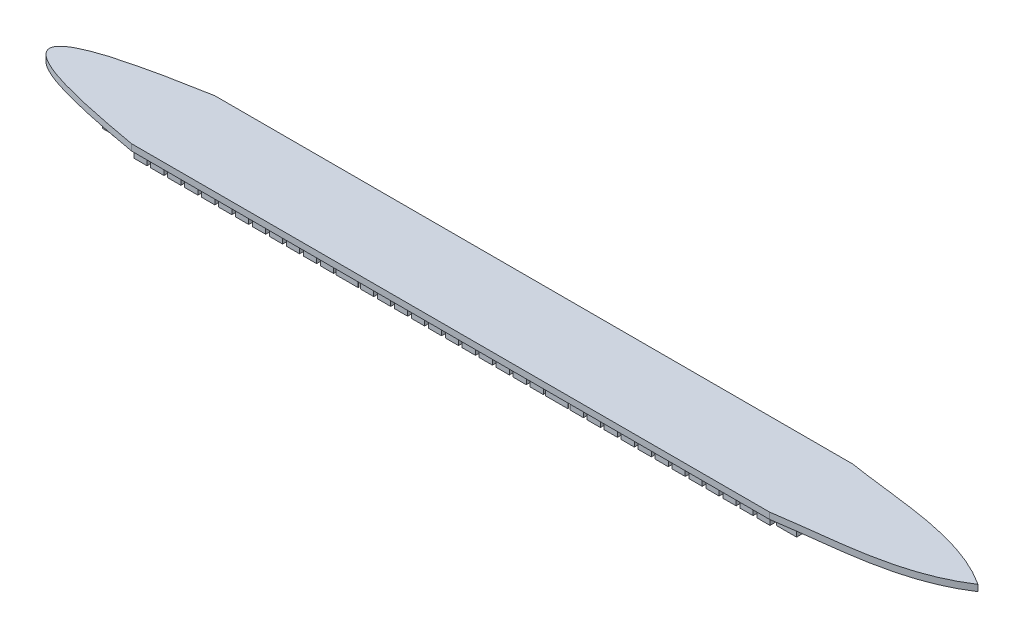
from build123d import *

# Parameters (mm, degrees)
SEATING_LAYOUT_W      = 457.2
SEATING_LAYOUT_H      = 635
SEATINGS_DEPTH        = 304.8
EMERGENCY_DOORS_W     = 30.48
EMERGENCY_DOORS_H     = 1066.8
EM_DOORS_DEPTH        = 304.8
EM_DOORS_2_DEPTH      = 304.8
EM_DOORS_3_DEPTH      = 304.8
EM_DOORS_4_DEPTH      = 304.8
LAVATORIES_W          = 1016
LAVATORIES_H          = 965.2
LAV_DEPTH             = 304.8
LAV_2_DEPTH           = 304.8
LAVATORIES_W_2        = 965.2
LAV_3_DEPTH           = 304.8
LAV_4_DEPTH           = 304.8
LAV_5_DEPTH           = 304.8
GALLEY_CARTS_W        = 914.4
GALLEY_CARTS_H        = 381
GALLEY_DEPTH          = 304.8
GALLEY_2_DEPTH        = 304.8
GALLEY_3_DEPTH        = 304.8
GALLEY_4_DEPTH        = 304.8
GALLEY_5_DEPTH        = 304.8
GALLEY_6_DEPTH        = 304.8
GALLEY_7_DEPTH        = 304.8
GALLEY_8_DEPTH        = 304.8
GALLEY_9_DEPTH        = 304.8
GALLEY_10_DEPTH       = 304.8
GALLEY_11_DEPTH       = 304.8
GALLEY_12_DEPTH       = 304.8
GALLEY_13_DEPTH       = 304.8
GALLEY_14_DEPTH       = 304.8
GALLEY_15_DEPTH       = 304.8
FLOOR_2_DEPTH         = 304.8
BODY_MOVE_COPY1_ANGLE = 90


with BuildPart() as part:
    # Seating layout → Seatings (new body)
    with BuildSketch(Plane(origin=(0, 0, 0), x_dir=(1, 0, 0), z_dir=(0, 1, 0))):
        with Locations((-1193.292, -14930.966666667)):
            Rectangle(SEATING_LAYOUT_W, SEATING_LAYOUT_H)
        with Locations((-1701.292, -14930.966666667)):
            Rectangle(SEATING_LAYOUT_W, SEATING_LAYOUT_H)
        with Locations((-685.292, -14930.966666667)):
            Rectangle(SEATING_LAYOUT_W, SEATING_LAYOUT_H)
        with Locations((-1193.292, -14118.166666667)):
            Rectangle(SEATING_LAYOUT_W, SEATING_LAYOUT_H)
        with Locations((-685.292, -14118.166666667)):
            Rectangle(SEATING_LAYOUT_W, SEATING_LAYOUT_H)
        with Locations((-1193.292, -13305.366666667)):
            Rectangle(SEATING_LAYOUT_W, SEATING_LAYOUT_H)
        with Locations((-685.292, -13305.366666667)):
            Rectangle(SEATING_LAYOUT_W, SEATING_LAYOUT_H)
        with Locations((-1701.292, -14118.166666667)):
            Rectangle(SEATING_LAYOUT_W, SEATING_LAYOUT_H)
        with Locations((-1701.292, -13305.366666667)):
            Rectangle(SEATING_LAYOUT_W, SEATING_LAYOUT_H)
        with Locations((-1701.292, -12492.566666667)):
            Rectangle(SEATING_LAYOUT_W, SEATING_LAYOUT_H)
        with Locations((-1193.292, -12492.566666667)):
            Rectangle(SEATING_LAYOUT_W, SEATING_LAYOUT_H)
        with Locations((-685.292, -12492.566666667)):
            Rectangle(SEATING_LAYOUT_W, SEATING_LAYOUT_H)
        with Locations((-1701.292, -11679.766666667)):
            Rectangle(SEATING_LAYOUT_W, SEATING_LAYOUT_H)
        with Locations((-1193.292, -11679.766666667)):
            Rectangle(SEATING_LAYOUT_W, SEATING_LAYOUT_H)
        with Locations((-685.292, -11679.766666667)):
            Rectangle(SEATING_LAYOUT_W, SEATING_LAYOUT_H)
        with Locations((-1701.292, -10866.966666667)):
            Rectangle(SEATING_LAYOUT_W, SEATING_LAYOUT_H)
        with Locations((-1193.292, -10866.966666667)):
            Rectangle(SEATING_LAYOUT_W, SEATING_LAYOUT_H)
        with Locations((-685.292, -10866.966666667)):
            Rectangle(SEATING_LAYOUT_W, SEATING_LAYOUT_H)
        with Locations((-1701.292, -10054.166666667)):
            Rectangle(SEATING_LAYOUT_W, SEATING_LAYOUT_H)
        with Locations((-1193.292, -10054.166666667)):
            Rectangle(SEATING_LAYOUT_W, SEATING_LAYOUT_H)
        with Locations((-685.292, -10054.166666667)):
            Rectangle(SEATING_LAYOUT_W, SEATING_LAYOUT_H)
        with Locations((-1701.292, -9241.366666667)):
            Rectangle(SEATING_LAYOUT_W, SEATING_LAYOUT_H)
        with Locations((-1193.292, -9241.366666667)):
            Rectangle(SEATING_LAYOUT_W, SEATING_LAYOUT_H)
        with Locations((-685.292, -9241.366666667)):
            Rectangle(SEATING_LAYOUT_W, SEATING_LAYOUT_H)
        with Locations((-1701.292, -8428.566666667)):
            Rectangle(SEATING_LAYOUT_W, SEATING_LAYOUT_H)
        with Locations((-1193.292, -8428.566666667)):
            Rectangle(SEATING_LAYOUT_W, SEATING_LAYOUT_H)
        with Locations((-685.292, -8428.566666667)):
            Rectangle(SEATING_LAYOUT_W, SEATING_LAYOUT_H)
        with Locations((-1701.292, -7615.766666667)):
            Rectangle(SEATING_LAYOUT_W, SEATING_LAYOUT_H)
        with Locations((-1193.292, -7615.766666667)):
            Rectangle(SEATING_LAYOUT_W, SEATING_LAYOUT_H)
        with Locations((-685.292, -7615.766666667)):
            Rectangle(SEATING_LAYOUT_W, SEATING_LAYOUT_H)
        with Locations((-1701.292, -6802.966666667)):
            Rectangle(SEATING_LAYOUT_W, SEATING_LAYOUT_H)
        with Locations((-1193.292, -6802.966666667)):
            Rectangle(SEATING_LAYOUT_W, SEATING_LAYOUT_H)
        with Locations((-685.292, -6802.966666667)):
            Rectangle(SEATING_LAYOUT_W, SEATING_LAYOUT_H)
        with Locations((-1701.292, -5990.166666667)):
            Rectangle(SEATING_LAYOUT_W, SEATING_LAYOUT_H)
        with Locations((-1193.292, -5990.166666667)):
            Rectangle(SEATING_LAYOUT_W, SEATING_LAYOUT_H)
        with Locations((-685.292, -5990.166666667)):
            Rectangle(SEATING_LAYOUT_W, SEATING_LAYOUT_H)
        with Locations((-1701.292, -4064)):
            Rectangle(SEATING_LAYOUT_W, SEATING_LAYOUT_H)
        with Locations((-1193.292, -4064)):
            Rectangle(SEATING_LAYOUT_W, SEATING_LAYOUT_H)
        with Locations((-685.292, -4064)):
            Rectangle(SEATING_LAYOUT_W, SEATING_LAYOUT_H)
        with Locations((-1193.292, -3251.2)):
            Rectangle(SEATING_LAYOUT_W, SEATING_LAYOUT_H)
        with Locations((-685.292, -3251.2)):
            Rectangle(SEATING_LAYOUT_W, SEATING_LAYOUT_H)
        with Locations((-1193.292, -2438.4)):
            Rectangle(SEATING_LAYOUT_W, SEATING_LAYOUT_H)
        with Locations((-685.292, -2438.4)):
            Rectangle(SEATING_LAYOUT_W, SEATING_LAYOUT_H)
        with Locations((-1193.292, -1625.6)):
            Rectangle(SEATING_LAYOUT_W, SEATING_LAYOUT_H)
        with Locations((-685.292, -1625.6)):
            Rectangle(SEATING_LAYOUT_W, SEATING_LAYOUT_H)
        with Locations((-1193.292, -812.8)):
            Rectangle(SEATING_LAYOUT_W, SEATING_LAYOUT_H)
        with Locations((-685.292, -812.8)):
            Rectangle(SEATING_LAYOUT_W, SEATING_LAYOUT_H)
        with Locations((-1701.292, -3251.2)):
            Rectangle(SEATING_LAYOUT_W, SEATING_LAYOUT_H)
        with Locations((-1701.292, -2438.4)):
            Rectangle(SEATING_LAYOUT_W, SEATING_LAYOUT_H)
        with Locations((-1701.292, -1625.6)):
            Rectangle(SEATING_LAYOUT_W, SEATING_LAYOUT_H)
        with Locations((-1701.292, -812.8)):
            Rectangle(SEATING_LAYOUT_W, SEATING_LAYOUT_H)
        with Locations((-1701.292, 0)):
            Rectangle(SEATING_LAYOUT_W, SEATING_LAYOUT_H)
        with Locations((-1193.292, 0)):
            Rectangle(SEATING_LAYOUT_W, SEATING_LAYOUT_H)
        with Locations((-685.292, 0)):
            Rectangle(SEATING_LAYOUT_W, SEATING_LAYOUT_H)
        with Locations((-1701.292, 812.8)):
            Rectangle(SEATING_LAYOUT_W, SEATING_LAYOUT_H)
        with Locations((-1193.292, 812.8)):
            Rectangle(SEATING_LAYOUT_W, SEATING_LAYOUT_H)
        with Locations((-685.292, 812.8)):
            Rectangle(SEATING_LAYOUT_W, SEATING_LAYOUT_H)
        with Locations((-1701.292, 1625.6)):
            Rectangle(SEATING_LAYOUT_W, SEATING_LAYOUT_H)
        with Locations((-1193.292, 1625.6)):
            Rectangle(SEATING_LAYOUT_W, SEATING_LAYOUT_H)
        with Locations((-685.292, 1625.6)):
            Rectangle(SEATING_LAYOUT_W, SEATING_LAYOUT_H)
        with Locations((-1701.292, 2438.4)):
            Rectangle(SEATING_LAYOUT_W, SEATING_LAYOUT_H)
        with Locations((-1193.292, 2438.4)):
            Rectangle(SEATING_LAYOUT_W, SEATING_LAYOUT_H)
        with Locations((-685.292, 2438.4)):
            Rectangle(SEATING_LAYOUT_W, SEATING_LAYOUT_H)
        with Locations((-1701.292, 3251.2)):
            Rectangle(SEATING_LAYOUT_W, SEATING_LAYOUT_H)
        with Locations((-1193.292, 3251.2)):
            Rectangle(SEATING_LAYOUT_W, SEATING_LAYOUT_H)
        with Locations((-685.292, 3251.2)):
            Rectangle(SEATING_LAYOUT_W, SEATING_LAYOUT_H)
        with Locations((-1701.292, 4064)):
            Rectangle(SEATING_LAYOUT_W, SEATING_LAYOUT_H)
        with Locations((-1193.292, 4064)):
            Rectangle(SEATING_LAYOUT_W, SEATING_LAYOUT_H)
        with Locations((-685.292, 4064)):
            Rectangle(SEATING_LAYOUT_W, SEATING_LAYOUT_H)
        with Locations((-685.292, 14930.966666667)):
            Rectangle(SEATING_LAYOUT_W, SEATING_LAYOUT_H)
        with Locations((-1193.292, 14930.966666667)):
            Rectangle(SEATING_LAYOUT_W, SEATING_LAYOUT_H)
        with Locations((-1701.292, 14930.966666667)):
            Rectangle(SEATING_LAYOUT_W, SEATING_LAYOUT_H)
        with Locations((-685.292, 5990.166666667)):
            Rectangle(SEATING_LAYOUT_W, SEATING_LAYOUT_H)
        with Locations((-1193.292, 5990.166666667)):
            Rectangle(SEATING_LAYOUT_W, SEATING_LAYOUT_H)
        with Locations((-1701.292, 5990.166666667)):
            Rectangle(SEATING_LAYOUT_W, SEATING_LAYOUT_H)
        with Locations((-685.292, 6802.966666667)):
            Rectangle(SEATING_LAYOUT_W, SEATING_LAYOUT_H)
        with Locations((-1193.292, 6802.966666667)):
            Rectangle(SEATING_LAYOUT_W, SEATING_LAYOUT_H)
        with Locations((-1701.292, 6802.966666667)):
            Rectangle(SEATING_LAYOUT_W, SEATING_LAYOUT_H)
        with Locations((-685.292, 7615.766666667)):
            Rectangle(SEATING_LAYOUT_W, SEATING_LAYOUT_H)
        with Locations((-1193.292, 7615.766666667)):
            Rectangle(SEATING_LAYOUT_W, SEATING_LAYOUT_H)
        with Locations((-1701.292, 7615.766666667)):
            Rectangle(SEATING_LAYOUT_W, SEATING_LAYOUT_H)
        with Locations((-685.292, 8428.566666667)):
            Rectangle(SEATING_LAYOUT_W, SEATING_LAYOUT_H)
        with Locations((-1193.292, 8428.566666667)):
            Rectangle(SEATING_LAYOUT_W, SEATING_LAYOUT_H)
        with Locations((-1701.292, 8428.566666667)):
            Rectangle(SEATING_LAYOUT_W, SEATING_LAYOUT_H)
        with Locations((-685.292, 9241.366666667)):
            Rectangle(SEATING_LAYOUT_W, SEATING_LAYOUT_H)
        with Locations((-1193.292, 9241.366666667)):
            Rectangle(SEATING_LAYOUT_W, SEATING_LAYOUT_H)
        with Locations((-1701.292, 9241.366666667)):
            Rectangle(SEATING_LAYOUT_W, SEATING_LAYOUT_H)
        with Locations((-685.292, 10054.166666667)):
            Rectangle(SEATING_LAYOUT_W, SEATING_LAYOUT_H)
        with Locations((-1193.292, 10054.166666667)):
            Rectangle(SEATING_LAYOUT_W, SEATING_LAYOUT_H)
        with Locations((-1701.292, 10054.166666667)):
            Rectangle(SEATING_LAYOUT_W, SEATING_LAYOUT_H)
        with Locations((-685.292, 10866.966666667)):
            Rectangle(SEATING_LAYOUT_W, SEATING_LAYOUT_H)
        with Locations((-1193.292, 10866.966666667)):
            Rectangle(SEATING_LAYOUT_W, SEATING_LAYOUT_H)
        with Locations((-1701.292, 10866.966666667)):
            Rectangle(SEATING_LAYOUT_W, SEATING_LAYOUT_H)
        with Locations((-685.292, 11679.766666667)):
            Rectangle(SEATING_LAYOUT_W, SEATING_LAYOUT_H)
        with Locations((-1193.292, 11679.766666667)):
            Rectangle(SEATING_LAYOUT_W, SEATING_LAYOUT_H)
        with Locations((-1701.292, 11679.766666667)):
            Rectangle(SEATING_LAYOUT_W, SEATING_LAYOUT_H)
        with Locations((-685.292, 12492.566666667)):
            Rectangle(SEATING_LAYOUT_W, SEATING_LAYOUT_H)
        with Locations((-1193.292, 12492.566666667)):
            Rectangle(SEATING_LAYOUT_W, SEATING_LAYOUT_H)
        with Locations((-1701.292, 12492.566666667)):
            Rectangle(SEATING_LAYOUT_W, SEATING_LAYOUT_H)
        with Locations((-1701.292, 13305.366666667)):
            Rectangle(SEATING_LAYOUT_W, SEATING_LAYOUT_H)
        with Locations((-1701.292, 14118.166666667)):
            Rectangle(SEATING_LAYOUT_W, SEATING_LAYOUT_H)
        with Locations((-685.292, 13305.366666667)):
            Rectangle(SEATING_LAYOUT_W, SEATING_LAYOUT_H)
        with Locations((-1193.292, 13305.366666667)):
            Rectangle(SEATING_LAYOUT_W, SEATING_LAYOUT_H)
        with Locations((-685.292, 14118.166666667)):
            Rectangle(SEATING_LAYOUT_W, SEATING_LAYOUT_H)
        with Locations((-1193.292, 14118.166666667)):
            Rectangle(SEATING_LAYOUT_W, SEATING_LAYOUT_H)
        with Locations((1193.292, 14930.966666667)):
            Rectangle(SEATING_LAYOUT_W, SEATING_LAYOUT_H)
        with Locations((1701.292, 14930.966666667)):
            Rectangle(SEATING_LAYOUT_W, SEATING_LAYOUT_H)
        with Locations((685.292, 14930.966666667)):
            Rectangle(SEATING_LAYOUT_W, SEATING_LAYOUT_H)
        with Locations((1193.292, 14118.166666667)):
            Rectangle(SEATING_LAYOUT_W, SEATING_LAYOUT_H)
        with Locations((685.292, 14118.166666667)):
            Rectangle(SEATING_LAYOUT_W, SEATING_LAYOUT_H)
        with Locations((1193.292, 13305.366666667)):
            Rectangle(SEATING_LAYOUT_W, SEATING_LAYOUT_H)
        with Locations((685.292, 13305.366666667)):
            Rectangle(SEATING_LAYOUT_W, SEATING_LAYOUT_H)
        with Locations((1701.292, 14118.166666667)):
            Rectangle(SEATING_LAYOUT_W, SEATING_LAYOUT_H)
        with Locations((1701.292, 13305.366666667)):
            Rectangle(SEATING_LAYOUT_W, SEATING_LAYOUT_H)
        with Locations((1701.292, 12492.566666667)):
            Rectangle(SEATING_LAYOUT_W, SEATING_LAYOUT_H)
        with Locations((1193.292, 12492.566666667)):
            Rectangle(SEATING_LAYOUT_W, SEATING_LAYOUT_H)
        with Locations((685.292, 12492.566666667)):
            Rectangle(SEATING_LAYOUT_W, SEATING_LAYOUT_H)
        with Locations((1701.292, 11679.766666667)):
            Rectangle(SEATING_LAYOUT_W, SEATING_LAYOUT_H)
        with Locations((1193.292, 11679.766666667)):
            Rectangle(SEATING_LAYOUT_W, SEATING_LAYOUT_H)
        with Locations((685.292, 11679.766666667)):
            Rectangle(SEATING_LAYOUT_W, SEATING_LAYOUT_H)
        with Locations((1701.292, 10866.966666667)):
            Rectangle(SEATING_LAYOUT_W, SEATING_LAYOUT_H)
        with Locations((1193.292, 10866.966666667)):
            Rectangle(SEATING_LAYOUT_W, SEATING_LAYOUT_H)
        with Locations((685.292, 10866.966666667)):
            Rectangle(SEATING_LAYOUT_W, SEATING_LAYOUT_H)
        with Locations((1701.292, 10054.166666667)):
            Rectangle(SEATING_LAYOUT_W, SEATING_LAYOUT_H)
        with Locations((1193.292, 10054.166666667)):
            Rectangle(SEATING_LAYOUT_W, SEATING_LAYOUT_H)
        with Locations((685.292, 10054.166666667)):
            Rectangle(SEATING_LAYOUT_W, SEATING_LAYOUT_H)
        with Locations((1701.292, 9241.366666667)):
            Rectangle(SEATING_LAYOUT_W, SEATING_LAYOUT_H)
        with Locations((1193.292, 9241.366666667)):
            Rectangle(SEATING_LAYOUT_W, SEATING_LAYOUT_H)
        with Locations((685.292, 9241.366666667)):
            Rectangle(SEATING_LAYOUT_W, SEATING_LAYOUT_H)
        with Locations((1701.292, 8428.566666667)):
            Rectangle(SEATING_LAYOUT_W, SEATING_LAYOUT_H)
        with Locations((1193.292, 8428.566666667)):
            Rectangle(SEATING_LAYOUT_W, SEATING_LAYOUT_H)
        with Locations((685.292, 8428.566666667)):
            Rectangle(SEATING_LAYOUT_W, SEATING_LAYOUT_H)
        with Locations((1701.292, 7615.766666667)):
            Rectangle(SEATING_LAYOUT_W, SEATING_LAYOUT_H)
        with Locations((1193.292, 7615.766666667)):
            Rectangle(SEATING_LAYOUT_W, SEATING_LAYOUT_H)
        with Locations((685.292, 7615.766666667)):
            Rectangle(SEATING_LAYOUT_W, SEATING_LAYOUT_H)
        with Locations((1701.292, 6802.966666667)):
            Rectangle(SEATING_LAYOUT_W, SEATING_LAYOUT_H)
        with Locations((1193.292, 6802.966666667)):
            Rectangle(SEATING_LAYOUT_W, SEATING_LAYOUT_H)
        with Locations((685.292, 6802.966666667)):
            Rectangle(SEATING_LAYOUT_W, SEATING_LAYOUT_H)
        with Locations((1701.292, 5990.166666667)):
            Rectangle(SEATING_LAYOUT_W, SEATING_LAYOUT_H)
        with Locations((1193.292, 5990.166666667)):
            Rectangle(SEATING_LAYOUT_W, SEATING_LAYOUT_H)
        with Locations((685.292, 5990.166666667)):
            Rectangle(SEATING_LAYOUT_W, SEATING_LAYOUT_H)
        with Locations((685.292, 4064)):
            Rectangle(SEATING_LAYOUT_W, SEATING_LAYOUT_H)
        with Locations((1193.292, 4064)):
            Rectangle(SEATING_LAYOUT_W, SEATING_LAYOUT_H)
        with Locations((1701.292, 4064)):
            Rectangle(SEATING_LAYOUT_W, SEATING_LAYOUT_H)
        with Locations((685.292, 3251.2)):
            Rectangle(SEATING_LAYOUT_W, SEATING_LAYOUT_H)
        with Locations((1193.292, 3251.2)):
            Rectangle(SEATING_LAYOUT_W, SEATING_LAYOUT_H)
        with Locations((1701.292, 3251.2)):
            Rectangle(SEATING_LAYOUT_W, SEATING_LAYOUT_H)
        with Locations((685.292, 2438.4)):
            Rectangle(SEATING_LAYOUT_W, SEATING_LAYOUT_H)
        with Locations((1193.292, 2438.4)):
            Rectangle(SEATING_LAYOUT_W, SEATING_LAYOUT_H)
        with Locations((1701.292, 2438.4)):
            Rectangle(SEATING_LAYOUT_W, SEATING_LAYOUT_H)
        with Locations((685.292, 1625.6)):
            Rectangle(SEATING_LAYOUT_W, SEATING_LAYOUT_H)
        with Locations((1193.292, 1625.6)):
            Rectangle(SEATING_LAYOUT_W, SEATING_LAYOUT_H)
        with Locations((1701.292, 1625.6)):
            Rectangle(SEATING_LAYOUT_W, SEATING_LAYOUT_H)
        with Locations((685.292, 812.8)):
            Rectangle(SEATING_LAYOUT_W, SEATING_LAYOUT_H)
        with Locations((1193.292, 812.8)):
            Rectangle(SEATING_LAYOUT_W, SEATING_LAYOUT_H)
        with Locations((1701.292, 812.8)):
            Rectangle(SEATING_LAYOUT_W, SEATING_LAYOUT_H)
        with Locations((685.292, 0)):
            Rectangle(SEATING_LAYOUT_W, SEATING_LAYOUT_H)
        with Locations((1193.292, 0)):
            Rectangle(SEATING_LAYOUT_W, SEATING_LAYOUT_H)
        with Locations((1701.292, 0)):
            Rectangle(SEATING_LAYOUT_W, SEATING_LAYOUT_H)
        with Locations((1701.292, -812.8)):
            Rectangle(SEATING_LAYOUT_W, SEATING_LAYOUT_H)
        with Locations((1701.292, -1625.6)):
            Rectangle(SEATING_LAYOUT_W, SEATING_LAYOUT_H)
        with Locations((1701.292, -2438.4)):
            Rectangle(SEATING_LAYOUT_W, SEATING_LAYOUT_H)
        with Locations((1701.292, -3251.2)):
            Rectangle(SEATING_LAYOUT_W, SEATING_LAYOUT_H)
        with Locations((685.292, -812.8)):
            Rectangle(SEATING_LAYOUT_W, SEATING_LAYOUT_H)
        with Locations((1193.292, -812.8)):
            Rectangle(SEATING_LAYOUT_W, SEATING_LAYOUT_H)
        with Locations((685.292, -1625.6)):
            Rectangle(SEATING_LAYOUT_W, SEATING_LAYOUT_H)
        with Locations((1193.292, -1625.6)):
            Rectangle(SEATING_LAYOUT_W, SEATING_LAYOUT_H)
        with Locations((685.292, -2438.4)):
            Rectangle(SEATING_LAYOUT_W, SEATING_LAYOUT_H)
        with Locations((1193.292, -2438.4)):
            Rectangle(SEATING_LAYOUT_W, SEATING_LAYOUT_H)
        with Locations((685.292, -3251.2)):
            Rectangle(SEATING_LAYOUT_W, SEATING_LAYOUT_H)
        with Locations((1193.292, -3251.2)):
            Rectangle(SEATING_LAYOUT_W, SEATING_LAYOUT_H)
        with Locations((685.292, -4064)):
            Rectangle(SEATING_LAYOUT_W, SEATING_LAYOUT_H)
        with Locations((1193.292, -4064)):
            Rectangle(SEATING_LAYOUT_W, SEATING_LAYOUT_H)
        with Locations((1701.292, -4064)):
            Rectangle(SEATING_LAYOUT_W, SEATING_LAYOUT_H)
        with Locations((685.292, -5990.166666667)):
            Rectangle(SEATING_LAYOUT_W, SEATING_LAYOUT_H)
        with Locations((1193.292, -5990.166666667)):
            Rectangle(SEATING_LAYOUT_W, SEATING_LAYOUT_H)
        with Locations((1701.292, -5990.166666667)):
            Rectangle(SEATING_LAYOUT_W, SEATING_LAYOUT_H)
        with Locations((685.292, -6802.966666667)):
            Rectangle(SEATING_LAYOUT_W, SEATING_LAYOUT_H)
        with Locations((1193.292, -6802.966666667)):
            Rectangle(SEATING_LAYOUT_W, SEATING_LAYOUT_H)
        with Locations((1701.292, -6802.966666667)):
            Rectangle(SEATING_LAYOUT_W, SEATING_LAYOUT_H)
        with Locations((685.292, -7615.766666667)):
            Rectangle(SEATING_LAYOUT_W, SEATING_LAYOUT_H)
        with Locations((1193.292, -7615.766666667)):
            Rectangle(SEATING_LAYOUT_W, SEATING_LAYOUT_H)
        with Locations((1701.292, -7615.766666667)):
            Rectangle(SEATING_LAYOUT_W, SEATING_LAYOUT_H)
        with Locations((685.292, -8428.566666667)):
            Rectangle(SEATING_LAYOUT_W, SEATING_LAYOUT_H)
        with Locations((1193.292, -8428.566666667)):
            Rectangle(SEATING_LAYOUT_W, SEATING_LAYOUT_H)
        with Locations((1701.292, -8428.566666667)):
            Rectangle(SEATING_LAYOUT_W, SEATING_LAYOUT_H)
        with Locations((685.292, -9241.366666667)):
            Rectangle(SEATING_LAYOUT_W, SEATING_LAYOUT_H)
        with Locations((1193.292, -9241.366666667)):
            Rectangle(SEATING_LAYOUT_W, SEATING_LAYOUT_H)
        with Locations((1701.292, -9241.366666667)):
            Rectangle(SEATING_LAYOUT_W, SEATING_LAYOUT_H)
        with Locations((685.292, -10054.166666667)):
            Rectangle(SEATING_LAYOUT_W, SEATING_LAYOUT_H)
        with Locations((1193.292, -10054.166666667)):
            Rectangle(SEATING_LAYOUT_W, SEATING_LAYOUT_H)
        with Locations((1701.292, -10054.166666667)):
            Rectangle(SEATING_LAYOUT_W, SEATING_LAYOUT_H)
        with Locations((685.292, -10866.966666667)):
            Rectangle(SEATING_LAYOUT_W, SEATING_LAYOUT_H)
        with Locations((1193.292, -10866.966666667)):
            Rectangle(SEATING_LAYOUT_W, SEATING_LAYOUT_H)
        with Locations((1701.292, -10866.966666667)):
            Rectangle(SEATING_LAYOUT_W, SEATING_LAYOUT_H)
        with Locations((685.292, -11679.766666667)):
            Rectangle(SEATING_LAYOUT_W, SEATING_LAYOUT_H)
        with Locations((1193.292, -11679.766666667)):
            Rectangle(SEATING_LAYOUT_W, SEATING_LAYOUT_H)
        with Locations((1701.292, -11679.766666667)):
            Rectangle(SEATING_LAYOUT_W, SEATING_LAYOUT_H)
        with Locations((685.292, -12492.566666667)):
            Rectangle(SEATING_LAYOUT_W, SEATING_LAYOUT_H)
        with Locations((1193.292, -12492.566666667)):
            Rectangle(SEATING_LAYOUT_W, SEATING_LAYOUT_H)
        with Locations((1701.292, -12492.566666667)):
            Rectangle(SEATING_LAYOUT_W, SEATING_LAYOUT_H)
        with Locations((1701.292, -13305.366666667)):
            Rectangle(SEATING_LAYOUT_W, SEATING_LAYOUT_H)
        with Locations((1701.292, -14118.166666667)):
            Rectangle(SEATING_LAYOUT_W, SEATING_LAYOUT_H)
        with Locations((685.292, -13305.366666667)):
            Rectangle(SEATING_LAYOUT_W, SEATING_LAYOUT_H)
        with Locations((1193.292, -13305.366666667)):
            Rectangle(SEATING_LAYOUT_W, SEATING_LAYOUT_H)
        with Locations((685.292, -14118.166666667)):
            Rectangle(SEATING_LAYOUT_W, SEATING_LAYOUT_H)
        with Locations((1193.292, -14118.166666667)):
            Rectangle(SEATING_LAYOUT_W, SEATING_LAYOUT_H)
        with Locations((685.292, -14930.966666667)):
            Rectangle(SEATING_LAYOUT_W, SEATING_LAYOUT_H)
        with Locations((1193.292, -14930.966666667)):
            Rectangle(SEATING_LAYOUT_W, SEATING_LAYOUT_H)
        with Locations((1701.292, -14930.966666667)):
            Rectangle(SEATING_LAYOUT_W, SEATING_LAYOUT_H)
    extrude(amount=SEATINGS_DEPTH)



with BuildPart() as body_2:
    # Emergency Doors → EM Doors (new body)
    with BuildSketch(Plane(origin=(0, 0, 0), x_dir=(1, 0, 0), z_dir=(0, 1, 0))):
        with Locations((-1914.652, 5027.083333333)):
            Rectangle(EMERGENCY_DOORS_W, EMERGENCY_DOORS_H)
    extrude(amount=EM_DOORS_DEPTH)


with BuildPart() as body_3:
    # Emergency Doors → EM Doors 2 (new body)
    with BuildSketch(Plane(origin=(0, 0, 0), x_dir=(1, 0, 0), z_dir=(0, 1, 0))):
        with Locations((1914.652, 5027.083333333)):
            Rectangle(EMERGENCY_DOORS_W, EMERGENCY_DOORS_H)
    extrude(amount=EM_DOORS_2_DEPTH)


with BuildPart() as body_4:
    # Emergency Doors → EM Doors 3 (new body)
    with BuildSketch(Plane(origin=(0, 0, 0), x_dir=(1, 0, 0), z_dir=(0, 1, 0))):
        with Locations((1914.652, -5027.083333333)):
            Rectangle(EMERGENCY_DOORS_W, EMERGENCY_DOORS_H)
    extrude(amount=EM_DOORS_3_DEPTH)


with BuildPart() as body_5:
    # Emergency Doors → EM Doors 4 (new body)
    with BuildSketch(Plane(origin=(0, 0, 0), x_dir=(1, 0, 0), z_dir=(0, 1, 0))):
        with Locations((-1914.652, -5027.083333333)):
            Rectangle(EMERGENCY_DOORS_W, EMERGENCY_DOORS_H)
    extrude(amount=EM_DOORS_4_DEPTH)


with BuildPart() as body_6:
    # Lavatories → LAV (new body)
    with BuildSketch(Plane(origin=(0, 0, 0), x_dir=(1, 0, 0), z_dir=(0, 1, 0))):
        with Locations((-1270.93486918, -15887.833325272)):
            Rectangle(LAVATORIES_W, LAVATORIES_H)
    extrude(amount=LAV_DEPTH)


with BuildPart() as body_7:
    # Lavatories → LAV 2 (new body)
    with BuildSketch(Plane(origin=(0, 0, 0), x_dir=(1, 0, 0), z_dir=(0, 1, 0))):
        with Locations((1270.93486918, -15887.833325272)):
            Rectangle(LAVATORIES_W, LAVATORIES_H)
    extrude(amount=LAV_2_DEPTH)


with BuildPart() as body_8:
    # Lavatories → LAV 3 (new body)
    with BuildSketch(Plane(origin=(0, 0, 0), x_dir=(1, 0, 0), z_dir=(0, 1, 0))):
        with Locations((0, 16219.247411075)):
            Rectangle(LAVATORIES_W_2, LAVATORIES_H)
    extrude(amount=LAV_3_DEPTH)


with BuildPart() as body_9:
    # Lavatories → LAV 4 (new body)
    with BuildSketch(Plane(origin=(0, 0, 0), x_dir=(1, 0, 0), z_dir=(0, 1, 0))):
        with Locations((-1016, 16219.247411075)):
            Rectangle(LAVATORIES_W_2, LAVATORIES_H)
    extrude(amount=LAV_4_DEPTH)


with BuildPart() as body_10:
    # Lavatories → LAV 5 (new body)
    with BuildSketch(Plane(origin=(0, 0, 0), x_dir=(1, 0, 0), z_dir=(0, 1, 0))):
        with Locations((1016, 16219.247411075)):
            Rectangle(LAVATORIES_W_2, LAVATORIES_H)
    extrude(amount=LAV_5_DEPTH)


with BuildPart() as body_11:
    # galley carts → Galley (new body)
    with BuildSketch(Plane(origin=(0, 0, 0), x_dir=(1, 0, 0), z_dir=(0, 1, 0))):
        with Locations((-684.604235921, -17110.363360042)):
            Rectangle(GALLEY_CARTS_W, GALLEY_CARTS_H)
    extrude(amount=GALLEY_DEPTH)


with BuildPart() as body_12:
    # galley carts → Galley 2 (new body)
    with BuildSketch(Plane(origin=(0, 0, 0), x_dir=(1, 0, 0), z_dir=(0, 1, 0))):
        with Locations((-684.604235921, -16626.124863435)):
            Rectangle(GALLEY_CARTS_W, GALLEY_CARTS_H)
    extrude(amount=GALLEY_2_DEPTH)


with BuildPart() as body_13:
    # galley carts → Galley 3 (new body)
    with BuildSketch(Plane(origin=(0, 0, 0), x_dir=(1, 0, 0), z_dir=(0, 1, 0))):
        with Locations((-684.604235921, -17594.601856648)):
            Rectangle(GALLEY_CARTS_W, GALLEY_CARTS_H)
    extrude(amount=GALLEY_3_DEPTH)


with BuildPart() as body_14:
    # galley carts → Galley 4 (new body)
    with BuildSketch(Plane(origin=(0, 0, 0), x_dir=(1, 0, 0), z_dir=(0, 1, 0))):
        with Locations((-684.604235921, -18078.840353255)):
            Rectangle(GALLEY_CARTS_W, GALLEY_CARTS_H)
    extrude(amount=GALLEY_4_DEPTH)


with BuildPart() as body_15:
    # galley carts → Galley 5 (new body)
    with BuildSketch(Plane(origin=(0, 0, 0), x_dir=(1, 0, 0), z_dir=(0, 1, 0))):
        with Locations((-684.604235921, -18563.078849861)):
            Rectangle(GALLEY_CARTS_W, GALLEY_CARTS_H)
    extrude(amount=GALLEY_5_DEPTH)


with BuildPart() as body_16:
    # galley carts → Galley 6 (new body)
    with BuildSketch(Plane(origin=(0, 0, 0), x_dir=(1, 0, 0), z_dir=(0, 1, 0))):
        with Locations((684.604235921, -18563.078849861)):
            Rectangle(GALLEY_CARTS_W, GALLEY_CARTS_H)
    extrude(amount=GALLEY_6_DEPTH)


with BuildPart() as body_17:
    # galley carts → Galley 7 (new body)
    with BuildSketch(Plane(origin=(0, 0, 0), x_dir=(1, 0, 0), z_dir=(0, 1, 0))):
        with Locations((684.604235921, -18078.840353255)):
            Rectangle(GALLEY_CARTS_W, GALLEY_CARTS_H)
    extrude(amount=GALLEY_7_DEPTH)


with BuildPart() as body_18:
    # galley carts → Galley 8 (new body)
    with BuildSketch(Plane(origin=(0, 0, 0), x_dir=(1, 0, 0), z_dir=(0, 1, 0))):
        with Locations((684.604235921, -17594.601856648)):
            Rectangle(GALLEY_CARTS_W, GALLEY_CARTS_H)
    extrude(amount=GALLEY_8_DEPTH)


with BuildPart() as body_19:
    # galley carts → Galley 9 (new body)
    with BuildSketch(Plane(origin=(0, 0, 0), x_dir=(1, 0, 0), z_dir=(0, 1, 0))):
        with Locations((684.604235921, -17110.363360042)):
            Rectangle(GALLEY_CARTS_W, GALLEY_CARTS_H)
    extrude(amount=GALLEY_9_DEPTH)


with BuildPart() as body_20:
    # galley carts → Galley 10 (new body)
    with BuildSketch(Plane(origin=(0, 0, 0), x_dir=(1, 0, 0), z_dir=(0, 1, 0))):
        with Locations((684.604235921, -16626.124863435)):
            Rectangle(GALLEY_CARTS_W, GALLEY_CARTS_H)
    extrude(amount=GALLEY_10_DEPTH)


with BuildPart() as body_21:
    # galley carts → Galley 11 (new body)
    with BuildSketch(Plane(origin=(0, 0, 0), x_dir=(1, 0, 0), z_dir=(0, 1, 0))):
        with Locations((0, 17031.641528704)):
            Rectangle(GALLEY_CARTS_W, GALLEY_CARTS_H)
    extrude(amount=GALLEY_11_DEPTH)


with BuildPart() as body_22:
    # galley carts → Galley 12 (new body)
    with BuildSketch(Plane(origin=(0, 0, 0), x_dir=(1, 0, 0), z_dir=(0, 1, 0))):
        with Locations((-991.393699307, 17031.641528704)):
            Rectangle(GALLEY_CARTS_W, GALLEY_CARTS_H)
    extrude(amount=GALLEY_12_DEPTH)


with BuildPart() as body_23:
    # galley carts → Galley 13 (new body)
    with BuildSketch(Plane(origin=(0, 0, 0), x_dir=(1, 0, 0), z_dir=(0, 1, 0))):
        with Locations((991.393699307, 17031.641528704)):
            Rectangle(GALLEY_CARTS_W, GALLEY_CARTS_H)
    extrude(amount=GALLEY_13_DEPTH)


with BuildPart() as body_24:
    # galley carts → Galley 14 (new body)
    with BuildSketch(Plane(origin=(0, 0, 0), x_dir=(1, 0, 0), z_dir=(0, 1, 0))):
        with Locations((534.193699307, 17475.007744754)):
            Rectangle(GALLEY_CARTS_W, GALLEY_CARTS_H)
    extrude(amount=GALLEY_14_DEPTH)


with BuildPart() as body_25:
    # galley carts → Galley 15 (new body)
    with BuildSketch(Plane(origin=(0, 0, 0), x_dir=(1, 0, 0), z_dir=(0, 1, 0))):
        with Locations((-534.193699307, 17475.007744754)):
            Rectangle(GALLEY_CARTS_W, GALLEY_CARTS_H)
    extrude(amount=GALLEY_15_DEPTH)


with BuildPart() as part_1:
    add(part.part)

    add(body_2.part)  # Floor 2 merges body 2

    add(body_3.part)  # Floor 2 merges body 3

    add(body_4.part)  # Floor 2 merges body 4

    add(body_5.part)  # Floor 2 merges body 5

    add(body_6.part)  # Floor 2 merges body 6

    add(body_7.part)  # Floor 2 merges body 7

    add(body_8.part)  # Floor 2 merges body 8

    add(body_9.part)  # Floor 2 merges body 9

    add(body_10.part)  # Floor 2 merges body 10

    add(body_11.part)  # Floor 2 merges body 11

    add(body_12.part)  # Floor 2 merges body 12

    add(body_13.part)  # Floor 2 merges body 13

    add(body_14.part)  # Floor 2 merges body 14

    add(body_15.part)  # Floor 2 merges body 15

    add(body_16.part)  # Floor 2 merges body 16

    add(body_17.part)  # Floor 2 merges body 17

    add(body_18.part)  # Floor 2 merges body 18

    add(body_19.part)  # Floor 2 merges body 19

    add(body_20.part)  # Floor 2 merges body 20

    add(body_21.part)  # Floor 2 merges body 21

    add(body_22.part)  # Floor 2 merges body 22

    add(body_23.part)  # Floor 2 merges body 23

    add(body_24.part)  # Floor 2 merges body 24

    add(body_25.part)  # Floor 2 merges body 25
    # Sketch1 → Floor 2 (add)
    with BuildSketch(Plane(origin=(0, 304.8, 0), x_dir=(1, 0, 0), z_dir=(0, 1, 0))):
        with BuildLine():
            Line((-1993.392, 15290.8), (-1993.392, -15290.8))
            add(Edge.make_bspline(
                [(-1993.392, -15290.8), (-1559.25347505, -17997.317209127), (-1562.644835379, -20899.998569501), (0, -23288.230279545)],
                knots=[0, 0, 0, 0, 1, 1, 1, 1], degree=3))
            add(Edge.make_bspline(
                [(1993.392, -15290.8), (1559.25347505, -17997.317209127), (1562.644835379, -20899.998569501), (0, -23288.230279545)],
                knots=[0, 0, 0, 0, 1, 1, 1, 1], degree=3))
            Line((1993.392, -15290.8), (1993.392, 15290.8))
            add(Edge.make_bspline(
                [(1993.392, 15290.8), (1893.439909662, 15823.797242359), (1726.985283471, 16759.188961799), (1477.77469384, 17951.649253862), (1243.478201871, 18879.257499343), (1035.03788507, 19670.532119139), (773.467892768, 20362.779016498), (516.062480311, 20853.377435911), (299.802852308, 21095.941869909), (164.679809858, 21179.459395374), (78.905811403, 21209.523745012), (26.409655882, 21215.846291729), (0, 21215.825071339)],
                knots=[0, 0, 0, 0, 0.253342233, 0.443909633, 0.568928661, 0.700369567, 0.825905763, 0.914050267, 0.957832597, 0.97546076, 0.987670389, 1, 1, 1, 1], degree=3))
            add(Edge.make_bspline(
                [(-1993.392, 15290.8), (-1893.439909662, 15823.797242359), (-1726.985283471, 16759.188961799), (-1477.77469384, 17951.649253862), (-1243.478201871, 18879.257499343), (-1035.03788507, 19670.532119139), (-773.467892768, 20362.779016498), (-516.062480311, 20853.377435911), (-299.802852308, 21095.941869909), (-164.679809858, 21179.459395374), (-78.905811403, 21209.523745012), (-26.409655882, 21215.846291729), (0, 21215.825071339)],
                knots=[0, 0, 0, 0, 0.253342233, 0.443909633, 0.568928661, 0.700369567, 0.825905763, 0.914050267, 0.957832597, 0.97546076, 0.987670389, 1, 1, 1, 1], degree=3))
        make_face()
    extrude(amount=FLOOR_2_DEPTH)


with BuildPart() as part_2:
    # Body-Move/Copy1: moved
    add(part_1.part.rotate(Axis((0, 0, 1036.191993908), (0, 1, 0)), BODY_MOVE_COPY1_ANGLE))


solid = part_2.part
